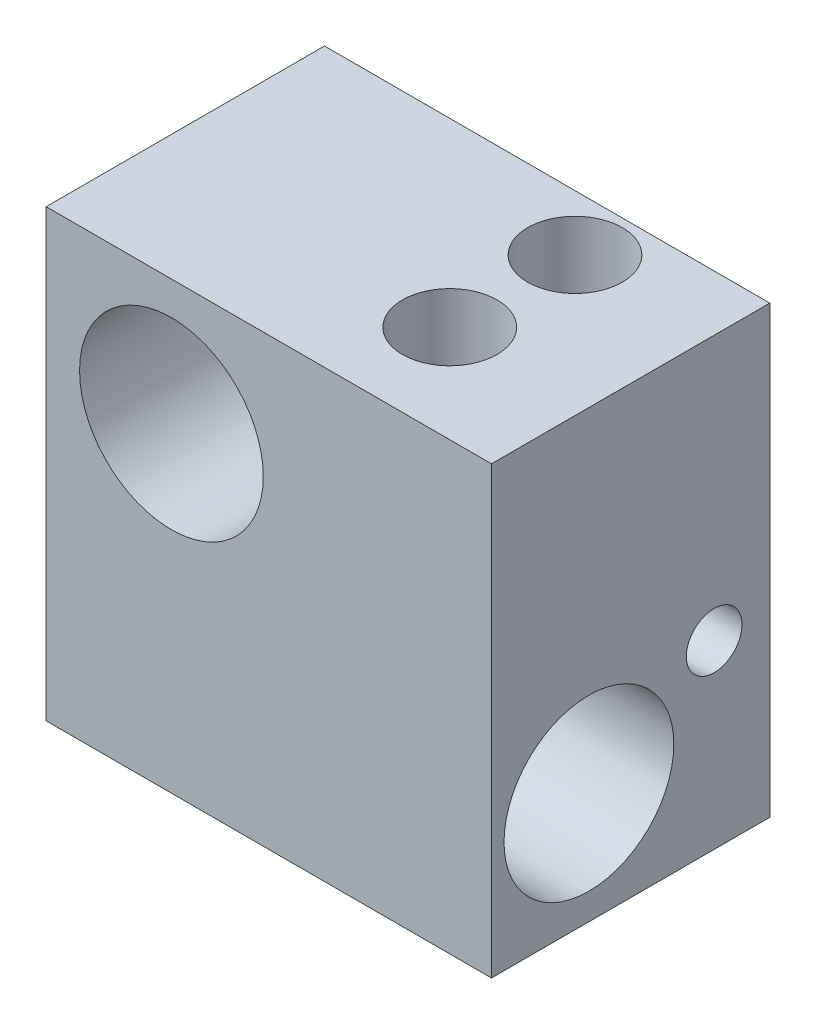
from build123d import *

# Parameters (mm, degrees)
ESQUISSE1_W                     = 16
ESQUISSE1_H                     = 16
BOSS_EXTRU_1_DEPTH              = 10
D_GAGEMENT_M61_D                = 6.6
DIAM_TRE_DU_PER_AGE_6_1_6_1_1_D = 6.1
DIAM_TRE_DU_PER_AGE_2_0_2_1_D   = 2
D_GAGEMENT_M31_D                = 3.4
D_GAGEMENT_M31_DEPTH            = 10
D_GAGEMENT_M32_D                = 3.4
D_GAGEMENT_M32_DEPTH            = 9.5


with BuildPart() as part:
    # Esquisse1 → Boss.-Extru.1 (new body)
    with BuildSketch(Plane.XY):
        with Locations((8, 8)):
            Rectangle(ESQUISSE1_W, ESQUISSE1_H)
    extrude(amount=BOSS_EXTRU_1_DEPTH)

    # Dégagement M61 (through all)
    with Locations(Plane.XY.offset(10)):
        with Locations((4.5, 11.5)):
            Hole(D_GAGEMENT_M61_D / 2)

    # Diamètre du perçage Ø6.1 (6.1)1 (through all)
    with Locations(Plane(origin=(16, 0, 0), x_dir=(0, 0, -1), z_dir=(1, 0, 0))):
        with Locations((-6.5, 4)):
            Hole(DIAM_TRE_DU_PER_AGE_6_1_6_1_1_D / 2)

    # Diamètre du perçage Ø2.0 (2)1 (through all)
    with Locations(Plane(origin=(16, 0, 0), x_dir=(0, 0, -1), z_dir=(1, 0, 0))):
        with Locations((-2, 6.5)):
            Hole(DIAM_TRE_DU_PER_AGE_2_0_2_1_D / 2)

    # Dégagement M31
    with Locations(Plane(origin=(0, 16, 0), x_dir=(1, 0, 0), z_dir=(0, 1, 0))):
        with Locations((11, -6.5)):
            Hole(D_GAGEMENT_M31_D / 2, depth=D_GAGEMENT_M31_DEPTH)

    # Dégagement M32
    with Locations(Plane(origin=(0, 16, 0), x_dir=(1, 0, 0), z_dir=(0, 1, 0))):
        with Locations((11, -2)):
            Hole(D_GAGEMENT_M32_D / 2, depth=D_GAGEMENT_M32_DEPTH)


solid = part.part
